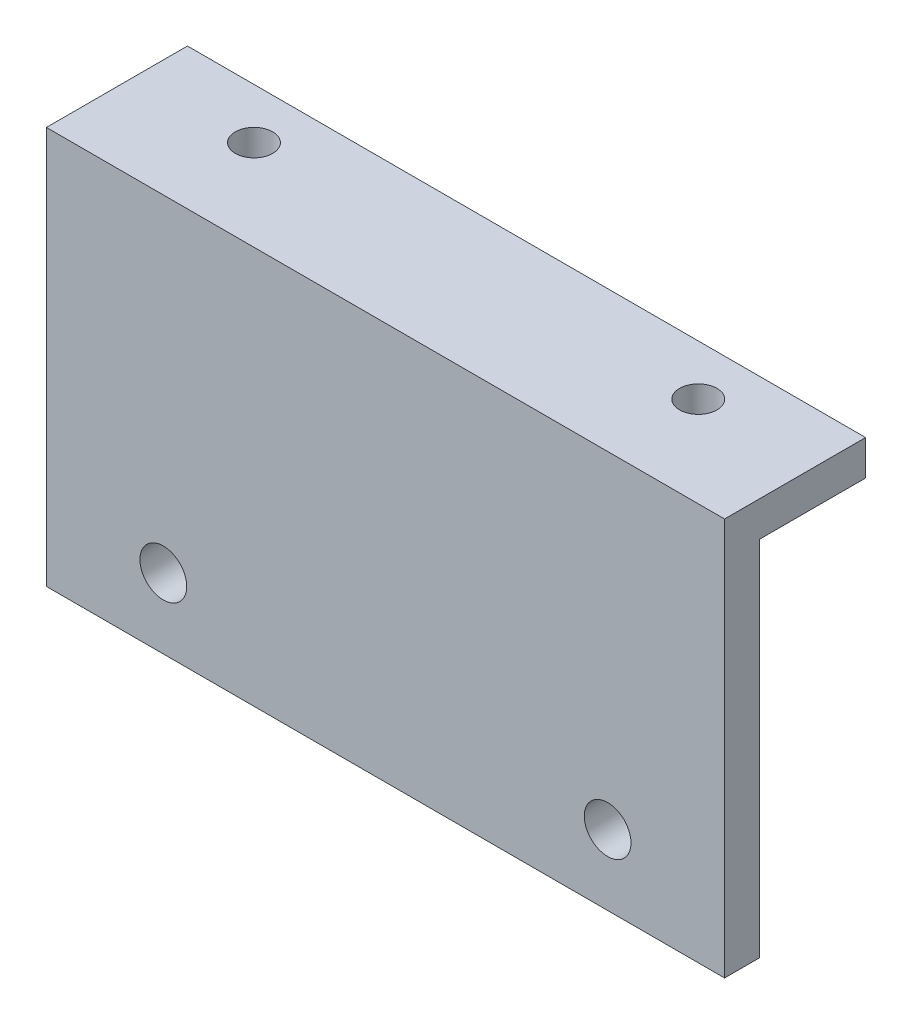
from build123d import *

# Parameters (mm, degrees)
SKETCH1_W           = 58
SKETCH1_H           = 34
SKETCH1_R           = 2
BOSS_EXTRUDE1_DEPTH = 3
SKETCH2_W           = 58
SKETCH2_H           = 12.062711374
SKETCH2_R           = 1.6
BOSS_EXTRUDE2_DEPTH = 3


with BuildPart() as part:
    # Sketch1 → Boss-Extrude1 (new body)
    with BuildSketch(Plane.XY):
        Rectangle(SKETCH1_W, SKETCH1_H)
        with Locations((-19, -11)):
            Circle(SKETCH1_R, mode=Mode.SUBTRACT)
        with Locations((19, -11)):
            Circle(SKETCH1_R, mode=Mode.SUBTRACT)
    extrude(amount=BOSS_EXTRUDE1_DEPTH)

    # Sketch2 → Boss-Extrude2 (add)
    with BuildSketch(Plane(origin=(0, 17, 0), x_dir=(1, 0, 0), z_dir=(0, 1, 0))):
        with Locations((0, 3.031355687)):
            Rectangle(SKETCH2_W, SKETCH2_H)
        with Locations((-19, 4.750652609)):
            Circle(SKETCH2_R, mode=Mode.SUBTRACT)
        with Locations((19, 4.750652609)):
            Circle(SKETCH2_R, mode=Mode.SUBTRACT)
    extrude(amount=-BOSS_EXTRUDE2_DEPTH)


solid = part.part
